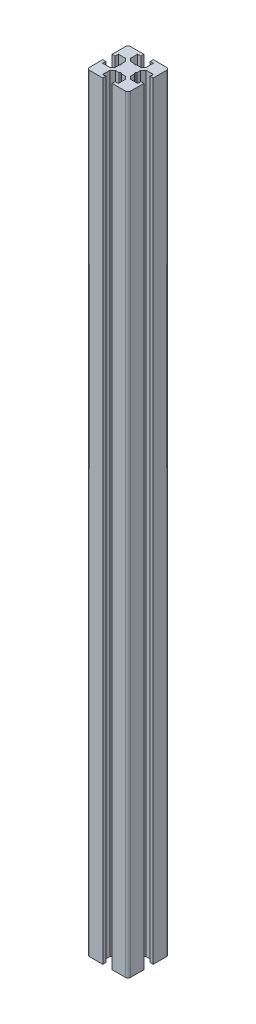
from build123d import *

# Parameters (mm, degrees)
BOSS_EXTRUDE1_DEPTH = 280


with BuildPart() as part:
    # Sketch2 → Boss-Extrude1 (new body)
    with BuildSketch(Plane(origin=(0, 0, 0), x_dir=(1, 0, 0), z_dir=(0, 1, 0))):
        with BuildLine():
            Line((1.7, 7.5), (6.5, 7.5))
            ThreePointArc((6.5, 7.5), (7.207106781, 7.207106781), (7.5, 6.5))
            Line((7.5, 6.5), (7.5, 1.7))
            Line((7.5, 1.7), (6.4, 1.7))
            Line((6.4, 1.7), (6.4, 2.85))
            Line((6.4, 2.85), (3.8, 2.85))
            Line((3.8, 2.85), (2.8, 1.85))
            Line((2.8, 1.85), (2.8, 0.519615242))
            Line((2.8, 0.519615242), (2.5, 0))
            Line((2.5, 0), (2.8, -0.519615242))
            Line((2.8, -0.519615242), (2.8, -1.85))
            Line((2.8, -1.85), (3.8, -2.85))
            Line((3.8, -2.85), (6.4, -2.85))
            Line((6.4, -2.85), (6.4, -1.7))
            Line((6.4, -1.7), (7.5, -1.7))
            Line((7.5, -1.7), (7.5, -6.5))
            ThreePointArc((7.5, -6.5), (7.207106781, -7.207106781), (6.5, -7.5))
            Line((6.5, -7.5), (1.7, -7.5))
            Line((1.7, -7.5), (1.7, -6.4))
            Line((1.7, -6.4), (2.85, -6.4))
            Line((2.85, -6.4), (2.85, -3.8))
            Line((2.85, -3.8), (1.85, -2.8))
            Line((1.85, -2.8), (0.519615242, -2.8))
            Line((0.519615242, -2.8), (0, -2.5))
            Line((0, -2.5), (-0.519615242, -2.8))
            Line((-0.519615242, -2.8), (-1.85, -2.8))
            Line((-1.85, -2.8), (-2.85, -3.8))
            Line((-2.85, -3.8), (-2.85, -6.4))
            Line((-2.85, -6.4), (-1.7, -6.4))
            Line((-1.7, -6.4), (-1.7, -7.5))
            Line((-1.7, -7.5), (-6.5, -7.5))
            ThreePointArc((-6.5, -7.5), (-7.207106781, -7.207106781), (-7.5, -6.5))
            Line((-7.5, -6.5), (-7.5, -1.7))
            Line((-7.5, -1.7), (-6.4, -1.7))
            Line((-6.4, -1.7), (-6.4, -2.85))
            Line((-6.4, -2.85), (-3.8, -2.85))
            Line((-3.8, -2.85), (-2.8, -1.85))
            Line((-2.8, -1.85), (-2.8, -0.519615242))
            Line((-2.8, -0.519615242), (-2.5, 0))
            Line((-2.5, 0), (-2.8, 0.519615242))
            Line((-2.8, 0.519615242), (-2.8, 1.85))
            Line((-2.8, 1.85), (-3.8, 2.85))
            Line((-3.8, 2.85), (-6.4, 2.85))
            Line((-6.4, 2.85), (-6.4, 1.7))
            Line((-6.4, 1.7), (-7.5, 1.7))
            Line((-7.5, 1.7), (-7.5, 6.5))
            ThreePointArc((-7.5, 6.5), (-7.207106781, 7.207106781), (-6.5, 7.5))
            Line((-6.5, 7.5), (-1.7, 7.5))
            Line((-1.7, 7.5), (-1.7, 6.4))
            Line((-1.7, 6.4), (-2.85, 6.4))
            Line((-2.85, 6.4), (-2.85, 3.8))
            Line((-2.85, 3.8), (-1.85, 2.8))
            Line((-1.85, 2.8), (-0.519615242, 2.8))
            Line((-0.519615242, 2.8), (0, 2.5))
            Line((0, 2.5), (0.519615242, 2.8))
            Line((0.519615242, 2.8), (1.85, 2.8))
            Line((1.85, 2.8), (2.85, 3.8))
            Line((2.85, 3.8), (2.85, 6.4))
            Line((2.85, 6.4), (1.7, 6.4))
            Line((1.7, 6.4), (1.7, 7.5))
        make_face()
    extrude(amount=BOSS_EXTRUDE1_DEPTH)


solid = part.part
